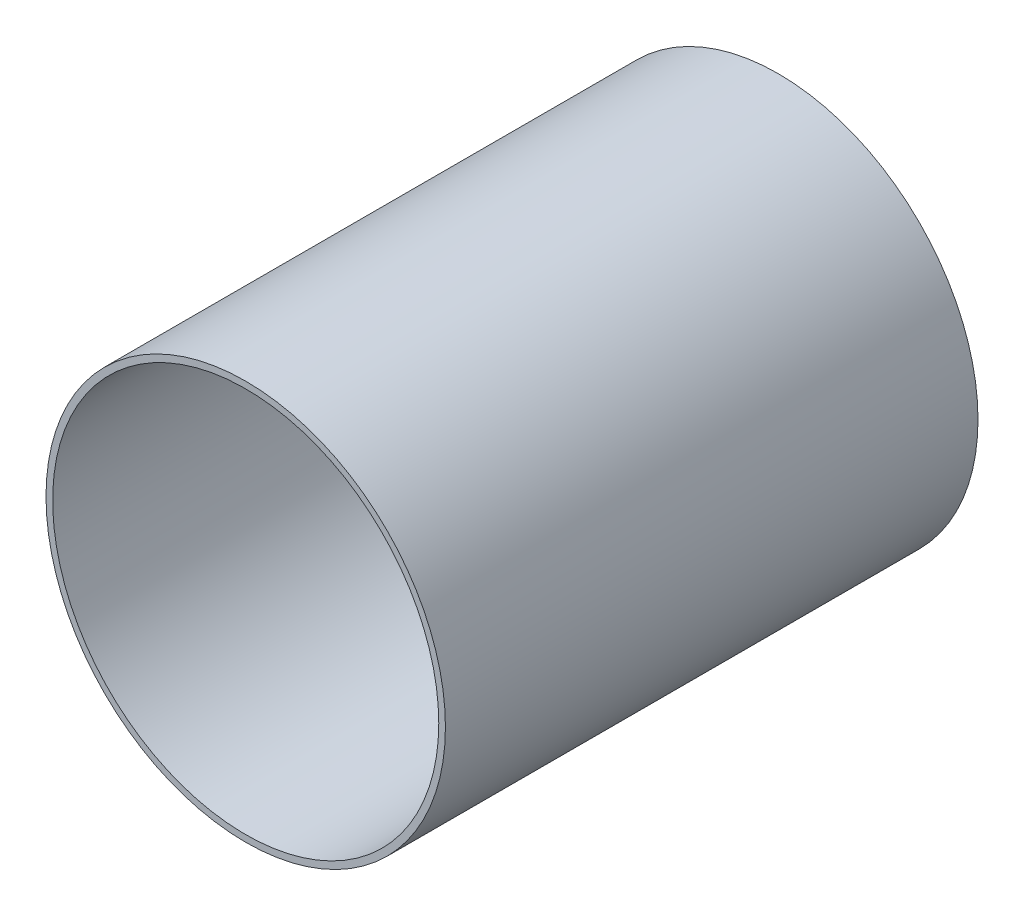
from build123d import *

# Parameters (mm, degrees)
SKETCH1_R           = 45
SKETCH1_R_2         = 43.5
BOSS_EXTRUDE1_DEPTH = 120


with BuildPart() as part:
    # Sketch1 → Boss-Extrude1 (new body)
    with BuildSketch(Plane.XY):
        Circle(SKETCH1_R)
        Circle(SKETCH1_R_2, mode=Mode.SUBTRACT)
    extrude(amount=BOSS_EXTRUDE1_DEPTH)


solid = part.part
